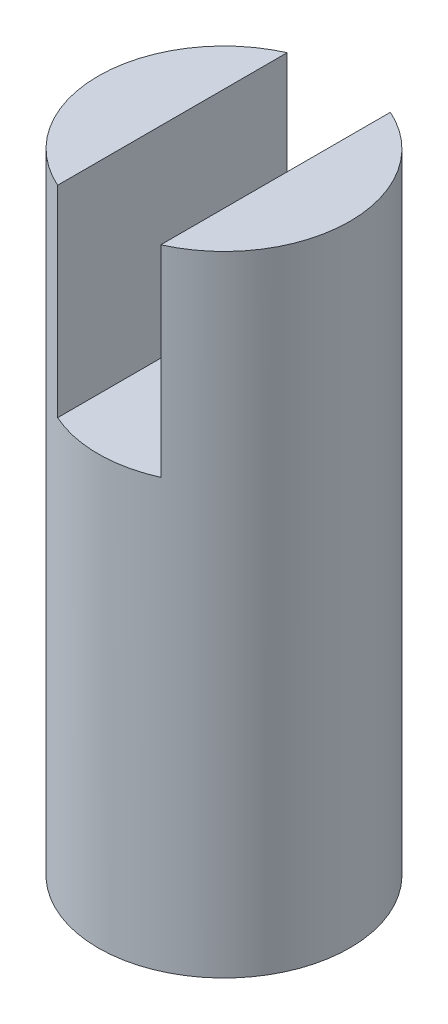
from build123d import *

# Parameters (mm, degrees)
BOSS_EXTRUDE1_OUTLINE_R = 5
BOSS_EXTRUDE1_DEPTH     = 25
SKETCH3_W               = 4.1
SKETCH3_H               = 10.495866356
CUT_EXTRUDE1_DEPTH      = 8
CUT_EXTRUDE2_DEPTH      = 10


# Read off the part's stored shape, not the designer's step: Boss-Extrude1
with BuildPart() as part:
    # Boss-Extrude1 outline → Boss-Extrude1 (new body)
    with BuildSketch(Plane(origin=(0, 0, 0), x_dir=(1, 0, 0), z_dir=(0, 1, 0))):
        Circle(BOSS_EXTRUDE1_OUTLINE_R)
    extrude(amount=BOSS_EXTRUDE1_DEPTH)

    # Sketch3 → Cut-Extrude1 (cut)
    with BuildSketch(Plane(origin=(0, 25, 0), x_dir=(1, 0, 0), z_dir=(0, 1, 0))):
        Rectangle(SKETCH3_W, SKETCH3_H)
    extrude(amount=-CUT_EXTRUDE1_DEPTH, mode=Mode.SUBTRACT)

    # Sketch2 → Cut-Extrude2 (cut)
    with BuildSketch(Plane.XZ):
        with BuildLine():
            Line((-2.3, 2.003122562), (-2.3, -2.003122562))
            ThreePointArc((-2.3, -2.003122562), (0, -3.05), (2.3, -2.003122562))
            Line((2.3, -2.003122562), (2.3, 2.003122562))
            ThreePointArc((2.3, 2.003122562), (0, 3.05), (-2.3, 2.003122562))
        make_face()
    extrude(amount=-CUT_EXTRUDE2_DEPTH, mode=Mode.SUBTRACT)


solid = part.part
